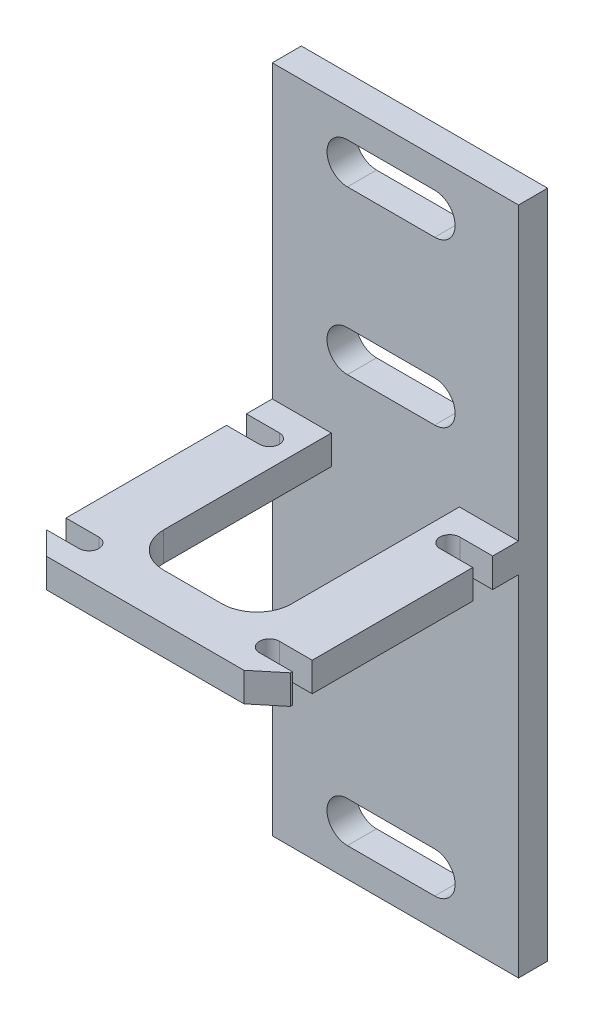
from build123d import *

# Parameters (mm, degrees)
BOSS_EXTRUDE1_DEPTH      = 5
CUT_EXTRUDE1_DEPTH       = 49.34188322
FILLET1_R                = 6
CUT_EXTRUDE2_DEPTH       = 49.34188322
BOSS_EXTRUDE4_DEPTH      = 50
BOSS_EXTRUDE4_DEPTH_BACK = 65
CUT_EXTRUDE5_DEPTH       = 10


with BuildPart() as part:
    # Sketch1 → Boss-Extrude1 (new body)
    with BuildSketch(Plane(origin=(0, 0, 0), x_dir=(1, 0, 0), z_dir=(0, 1, 0))):
        Polygon((-10.255294708, 3.008405172), (11.744705292, 3.008405172), (11.744705292, 42.808405172), (21.894705292, 42.808405172), (21.894705292, 3.008405172), (21.894705292, -4.991594828), (-20.405294708, -4.991594828), (-20.405294708, 3.008405172), (-20.405294708, 42.808405172), (-10.255294708, 42.808405172), align=None)
    extrude(amount=BOSS_EXTRUDE1_DEPTH)

    # Sketch2 → Cut-Extrude1 (cut, through all)
    with BuildSketch(Plane.XZ):
        with BuildLine():
            Line((-20.405294708, -33.368405172), (-14.755294708, -33.368405172))
            ThreePointArc((-14.755294708, -33.368405172), (-13.045294708, -31.658405172), (-14.755294708, -29.948405172))
            Line((-14.755294708, -29.948405172), (-20.405294708, -29.948405172))
            Line((-20.405294708, -29.948405172), (-20.405294708, -33.368405172))
        make_face()
        with BuildLine():
            Line((-20.405294708, -2.368405172), (-14.755294708, -2.368405172))
            ThreePointArc((-14.755294708, -2.368405172), (-13.045294708, -0.658405172), (-14.755294708, 1.051594828))
            Line((-14.755294708, 1.051594828), (-20.405294708, 1.051594828))
            Line((-20.405294708, 1.051594828), (-20.405294708, -2.368405172))
        make_face()
        with BuildLine():
            Line((21.894705292, 1.051594828), (16.244705292, 1.051594828))
            ThreePointArc((16.244705292, 1.051594828), (14.534705292, -0.658405172), (16.244705292, -2.368405172))
            Line((16.244705292, -2.368405172), (21.894705292, -2.368405172))
            Line((21.894705292, -2.368405172), (21.894705292, 1.051594828))
        make_face()
        with BuildLine():
            Line((21.894705292, -29.948405172), (16.244705292, -29.948405172))
            ThreePointArc((16.244705292, -29.948405172), (14.534705292, -31.658405172), (16.244705292, -33.368405172))
            Line((16.244705292, -33.368405172), (21.894705292, -33.368405172))
            Line((21.894705292, -33.368405172), (21.894705292, -29.948405172))
        make_face()
    extrude(amount=-CUT_EXTRUDE1_DEPTH, mode=Mode.SUBTRACT)

    # Fillet1
    fillet1_edges = [part.edges().sort_by_distance(p)[0] for p in [
        (-10.255294708, 2.5, -3.008405172),
        (11.744705292, 2.5, -3.008405172),
    ]]
    fillet(fillet1_edges, radius=FILLET1_R)

    # Sketch3 → Cut-Extrude2 (cut, through all)
    with BuildSketch(Plane.XZ):
        Polygon((21.894705292, 1.391259285), (17.527419638, 4.991594828), (21.894705292, 4.991594828), align=None)
        Polygon((-20.405294708, 0.994660971), (-16.397786785, 4.991594828), (-20.405294708, 4.991594828), align=None)
    extrude(amount=-CUT_EXTRUDE2_DEPTH, mode=Mode.SUBTRACT)

    # Sketch5 → Boss-Extrude4 (add, two sides: drawn at the far end of the back side and taken through both)
    with BuildSketch(Plane(origin=(0, 5, 0), x_dir=(1, 0, 0), z_dir=(0, 1, 0)).offset(-BOSS_EXTRUDE4_DEPTH_BACK)):
        Polygon((21.894705292, 42.808405172), (-10.255294708, 42.808405172), (-20.405294708, 42.808405172), (-20.405294708, 37.808405172), (-10.255294708, 37.808405172), (21.894705292, 37.808405172), align=None)
    extrude(amount=BOSS_EXTRUDE4_DEPTH + BOSS_EXTRUDE4_DEPTH_BACK)

    # Sketch8 → Cut-Extrude5 (cut)
    with BuildSketch(Plane.XY.offset(-37.808405172)):
        with BuildLine():
            Line((-7.5, 22.06), (7.5, 22.06))
            ThreePointArc((7.5, 22.06), (11, 18.56), (7.5, 15.06))
            Line((7.5, 15.06), (-7.5, 15.06))
            ThreePointArc((-7.5, 15.06), (-11, 18.56), (-7.5, 22.06))
        make_face()
        with BuildLine():
            Line((7.5, -55), (-7.5, -55))
            ThreePointArc((-7.5, -55), (-11, -51.5), (-7.5, -48))
            Line((-7.5, -48), (7.5, -48))
            ThreePointArc((7.5, -48), (11, -51.5), (7.5, -55))
        make_face()
        with BuildLine():
            Line((-7.5, 50), (7.5, 50))
            ThreePointArc((7.5, 50), (11, 46.5), (7.5, 43))
            Line((7.5, 43), (-7.5, 43))
            ThreePointArc((-7.5, 43), (-11, 46.5), (-7.5, 50))
        make_face()
    extrude(amount=-CUT_EXTRUDE5_DEPTH, mode=Mode.SUBTRACT)


solid = part.part
